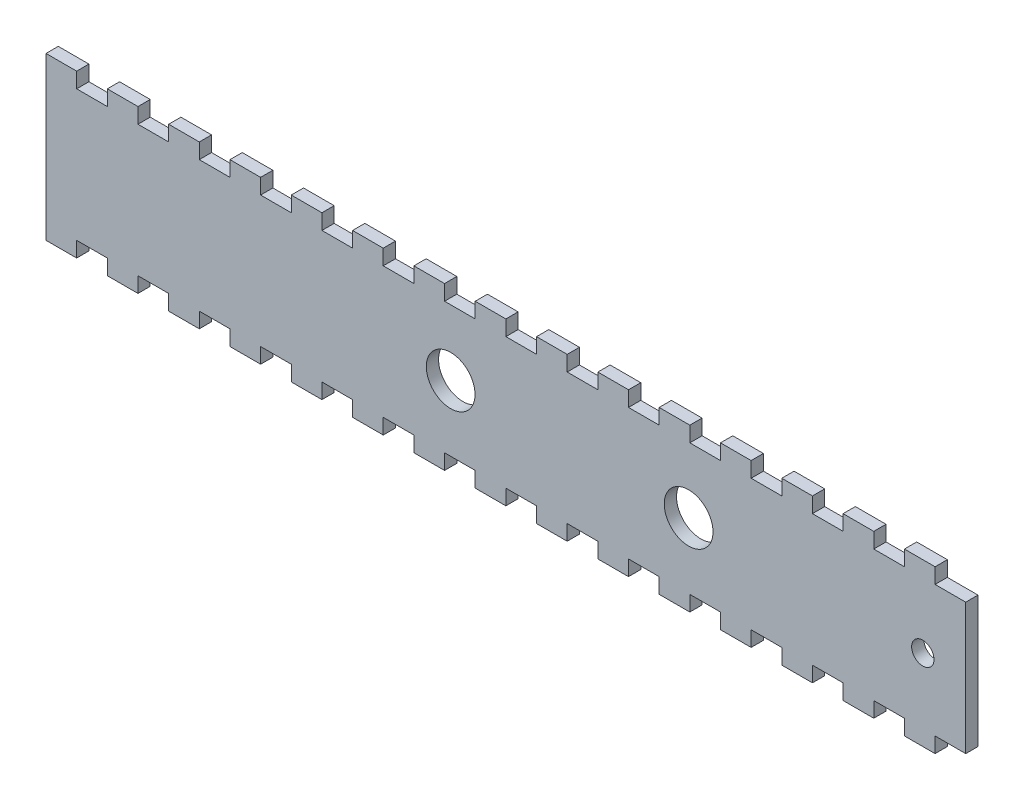
from build123d import *

# Parameters (mm, degrees)
SKETCH1_W           = 150
SKETCH1_H           = 21.4
SKETCH1_R           = 1.825
SKETCH1_R_2         = 3.975
BOSS_EXTRUDE2_DEPTH = 2
SKETCH2_W           = 5
SKETCH2_H           = 2
BOSS_EXTRUDE3_DEPTH = 2.5
LPATTERN1_COUNT     = 15
LPATTERN1_PITCH     = 10
SKETCH3_W           = 5
SKETCH3_H           = 2
BOSS_EXTRUDE4_DEPTH = 2.5
LPATTERN2_COUNT     = 15
LPATTERN2_PITCH     = 10


with BuildPart() as part:
    # Sketch1 → Boss-Extrude2 (new body)
    with BuildSketch(Plane.XY):
        with Locations((75, 10.7)):
            Rectangle(SKETCH1_W, SKETCH1_H)
        with Locations((143, 10.7)):
            Circle(SKETCH1_R, mode=Mode.SUBTRACT)
        with Locations((104.805, 10.7)):
            Circle(SKETCH1_R_2, mode=Mode.SUBTRACT)
        with Locations((65.995, 10.7)):
            Circle(SKETCH1_R_2, mode=Mode.SUBTRACT)
    extrude(amount=BOSS_EXTRUDE2_DEPTH)

    # Sketch2 → Boss-Extrude3 (add)
    with BuildSketch(Plane(origin=(0, 21.4, 0), x_dir=(1, 0, 0), z_dir=(0, 1, 0))):
        with Locations((2.5, -1)):
            Rectangle(SKETCH2_W, SKETCH2_H)
    boss_extrude3 = extrude(amount=BOSS_EXTRUDE3_DEPTH)

    # LPattern1: Boss-Extrude3 ×15
    with Locations(*[(i * LPATTERN1_PITCH, 0, 0) for i in range(1, LPATTERN1_COUNT)]):
        add(boss_extrude3)

    # Sketch3 → Boss-Extrude4 (add)
    with BuildSketch(Plane(origin=(0, 0, 0), x_dir=(-1, 0, 0), z_dir=(0, -1, 0))):
        with Locations((-2.5, -1)):
            Rectangle(SKETCH3_W, SKETCH3_H)
    boss_extrude4 = extrude(amount=BOSS_EXTRUDE4_DEPTH)

    # LPattern2: Boss-Extrude4 ×15
    with Locations(*[(i * LPATTERN2_PITCH, 0, 0) for i in range(1, LPATTERN2_COUNT)]):
        add(boss_extrude4)


solid = part.part
